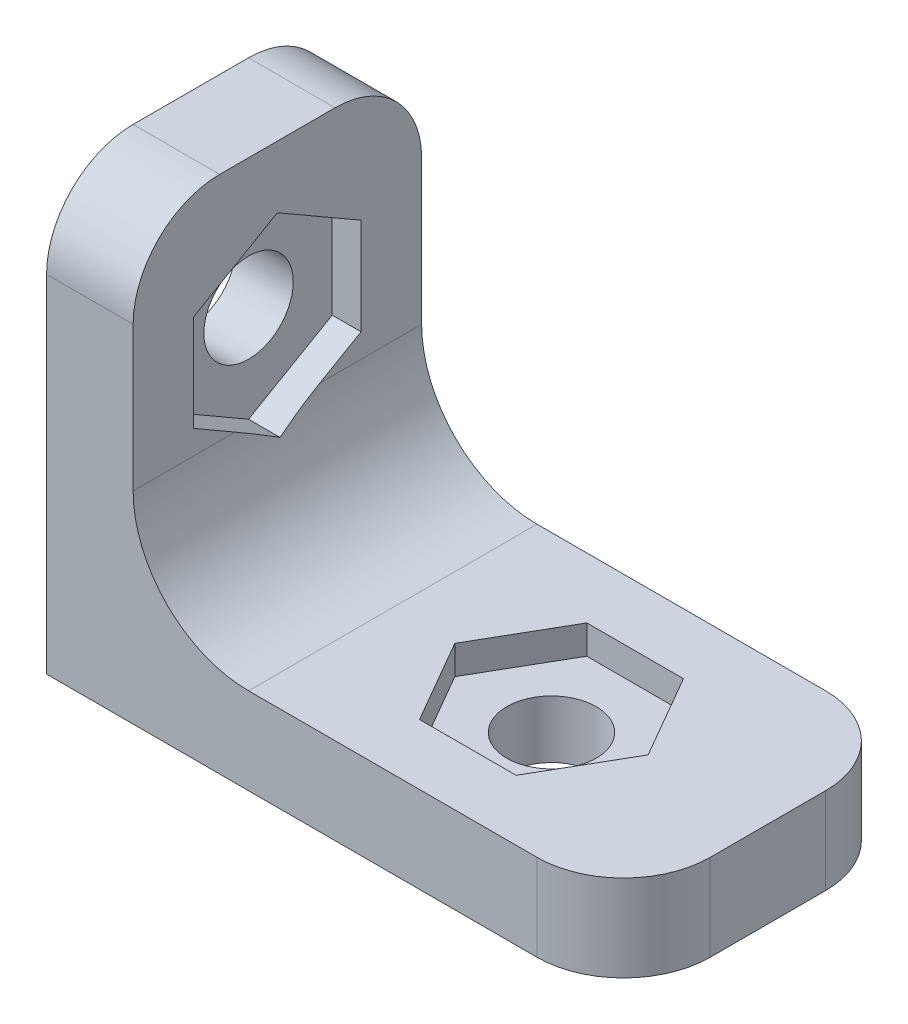
from build123d import *

# Parameters (mm, degrees)
CROQUIS1_W              = 20
CROQUIS1_H              = 10
CROQUIS1_R              = 1.55
SALIENTE_EXTRUIR1_DEPTH = 3
CROQUIS2_W              = 3
CROQUIS2_H              = 10
SALIENTE_EXTRUIR2_DEPTH = 12
CROQUIS3_R              = 1.55
CORTAR_EXTRUIR1_DEPTH   = 3
CORTAR_EXTRUIR3_DEPTH   = 1
REDONDEO1_R             = 3
REDONDEO2_R             = 4
CORTAR_EXTRUIR4_DEPTH   = 1


with BuildPart() as part:
    # Croquis1 → Saliente-Extruir1 (new body)
    with BuildSketch(Plane(origin=(0, 0, 0), x_dir=(1, 0, 0), z_dir=(0, 1, 0))):
        with Locations((10, 5)):
            Rectangle(CROQUIS1_W, CROQUIS1_H)
        with Locations(Location((12.5, 5, 0), (0, 0, 270))):
            Circle(CROQUIS1_R, mode=Mode.SUBTRACT)
    extrude(amount=SALIENTE_EXTRUIR1_DEPTH)

    # Croquis2 → Saliente-Extruir2 (add)
    with BuildSketch(Plane(origin=(0, 3, 0), x_dir=(1, 0, 0), z_dir=(0, 1, 0))):
        with Locations((1.5, 5)):
            Rectangle(CROQUIS2_W, CROQUIS2_H)
    extrude(amount=SALIENTE_EXTRUIR2_DEPTH)

    # Croquis3 → Cortar-Extruir1 (cut)
    with BuildSketch(Plane.ZY):
        with Locations((-5, 9.5)):
            Circle(CROQUIS3_R)
    extrude(amount=-CORTAR_EXTRUIR1_DEPTH, mode=Mode.SUBTRACT)

    # Croquis5 → Cortar-Extruir3 (cut)
    with BuildSketch(Plane(origin=(3, 0, 0), x_dir=(0, 0, -1), z_dir=(1, 0, 0))):
        Polygon((7.9, 11.174315781), (5, 12.848631561), (2.1, 11.174315781), (2.1, 7.825684219), (5, 6.151368439), (7.9, 7.825684219), align=None)
    extrude(amount=-CORTAR_EXTRUIR3_DEPTH, mode=Mode.SUBTRACT)

    # Redondeo1
    redondeo1_edges = [part.edges().sort_by_distance(p)[0] for p in [
        (1.5, 15, 0),
        (1.5, 15, -10),
        (20, 1.5, -10),
        (20, 1.5, 0),
    ]]
    fillet(redondeo1_edges, radius=REDONDEO1_R)

    # Redondeo2
    # the kernel refuses this fillet: 4 mm, written as the material it adds along each edge
    with BuildSketch(Plane(origin=(3, 3, -10), x_dir=(0, 1, 0), z_dir=(0, 0, 1))) as redondeo2_piece_1_section:
        with BuildLine():
            CenterArc((REDONDEO2_R, -REDONDEO2_R), REDONDEO2_R, 90, 90)
            Line((0, -REDONDEO2_R), (0, 0))
            Line((0, 0), (REDONDEO2_R, 0))
        make_face()
    redondeo2_piece_1 = extrude(amount=10, mode=Mode.PRIVATE)
    redondeo2_piece_1 = split(redondeo2_piece_1, bisect_by=Plane(origin=(3.346509798, 4.243965629, -8.303718576), z_dir=(0, 0.8660254037844384, -0.5000000000000007)), keep=Keep.TOP, mode=Mode.PRIVATE)
    redondeo2_piece_1 = split(redondeo2_piece_1, bisect_by=Plane(origin=(3.346509798, 7.41640276, -7.191103718), z_dir=(0, -0.8660254037844387, -0.5)), keep=Keep.TOP, mode=Mode.PRIVATE)
    add(redondeo2_piece_1)
    with BuildSketch(Plane(origin=(3, 3, -10), x_dir=(0, 1, 0), z_dir=(0, 0, 1))) as redondeo2_piece_2_section:
        with BuildLine():
            CenterArc((REDONDEO2_R, -REDONDEO2_R), REDONDEO2_R, 90, 90)
            Line((0, -REDONDEO2_R), (0, 0))
            Line((0, 0), (REDONDEO2_R, 0))
        make_face()
    redondeo2_piece_2 = extrude(amount=10, mode=Mode.PRIVATE)
    redondeo2_piece_2 = split(redondeo2_piece_2, bisect_by=Plane(origin=(4.081067975, 5.513393982, -6.105004173), z_dir=(0, -0.8660254037844384, 0.5000000000000007)), keep=Keep.TOP, mode=Mode.PRIVATE)
    redondeo2_piece_2 = split(redondeo2_piece_2, bisect_by=Plane(origin=(4.081067975, 5.513393982, -3.894995827), z_dir=(0, -0.8660254037844387, -0.5)), keep=Keep.TOP, mode=Mode.PRIVATE)
    add(redondeo2_piece_2)
    with BuildSketch(Plane(origin=(3, 3, -10), x_dir=(0, 1, 0), z_dir=(0, 0, 1))) as redondeo2_piece_3_section:
        with BuildLine():
            CenterArc((REDONDEO2_R, -REDONDEO2_R), REDONDEO2_R, 90, 90)
            Line((0, -REDONDEO2_R), (0, 0))
            Line((0, 0), (REDONDEO2_R, 0))
        make_face()
    redondeo2_piece_3 = extrude(amount=10, mode=Mode.PRIVATE)
    redondeo2_piece_3 = split(redondeo2_piece_3, bisect_by=Plane(origin=(3.346509798, 7.41640276, -2.808896282), z_dir=(0, -0.8660254037844384, 0.5000000000000007)), keep=Keep.TOP, mode=Mode.PRIVATE)
    redondeo2_piece_3 = split(redondeo2_piece_3, bisect_by=Plane(origin=(3.346509798, 4.243965629, -1.696281424), z_dir=(0, 0.8660254037844387, 0.5)), keep=Keep.TOP, mode=Mode.PRIVATE)
    add(redondeo2_piece_3)

    # Croquis6 → Cortar-Extruir4 (cut)
    with BuildSketch(Plane(origin=(0, 3, 0), x_dir=(1, 0, 0), z_dir=(0, 1, 0))):
        Polygon((14.174315781, 7.9), (10.825684219, 7.9), (9.151368439, 5), (10.825684219, 2.1), (14.174315781, 2.1), (15.848631561, 5), align=None)
    extrude(amount=-CORTAR_EXTRUIR4_DEPTH, mode=Mode.SUBTRACT)


solid = part.part
